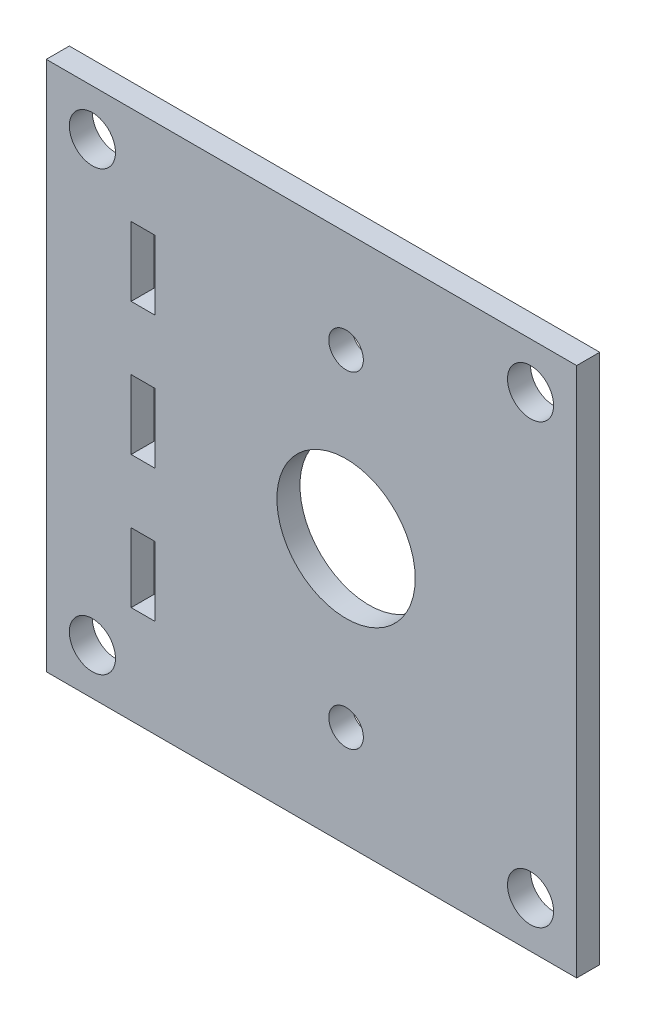
from build123d import *

# Parameters (mm, degrees)
SKETCH1_W           = 146.05
SKETCH1_H           = 146.05
SKETCH1_R           = 6.35
SKETCH1_R_2         = 19.05
SKETCH1_R_3         = 4.7625
SKETCH1_W_2         = 6.604
SKETCH1_H_2         = 19.05
BOSS_EXTRUDE1_DEPTH = 3.175


with BuildPart() as part:
    # Sketch1 → Boss-Extrude1 (new, symmetric)
    with BuildSketch(Plane.XY):
        with Locations((-9.525, 0)):
            Rectangle(SKETCH1_W, SKETCH1_H)
        with Locations((50.8, 60.325)):
            Circle(SKETCH1_R, mode=Mode.SUBTRACT)
        with Locations((50.8, -60.325)):
            Circle(SKETCH1_R, mode=Mode.SUBTRACT)
        Circle(SKETCH1_R_2, mode=Mode.SUBTRACT)
        with Locations((0, 45)):
            Circle(SKETCH1_R_3, mode=Mode.SUBTRACT)
        with Locations((0, -45)):
            Circle(SKETCH1_R_3, mode=Mode.SUBTRACT)
        with Locations((-69.85, 60.325)):
            Circle(SKETCH1_R, mode=Mode.SUBTRACT)
        with Locations((-69.85, -60.325)):
            Circle(SKETCH1_R, mode=Mode.SUBTRACT)
        with Locations((-55.88, 0)):
            Rectangle(SKETCH1_W_2, SKETCH1_H_2, mode=Mode.SUBTRACT)
        with Locations((-55.88, 36.5125)):
            Rectangle(SKETCH1_W_2, SKETCH1_H_2, mode=Mode.SUBTRACT)
        with Locations((-55.88, -36.5125)):
            Rectangle(SKETCH1_W_2, SKETCH1_H_2, mode=Mode.SUBTRACT)
    extrude(amount=BOSS_EXTRUDE1_DEPTH, both=True)


solid = part.part
